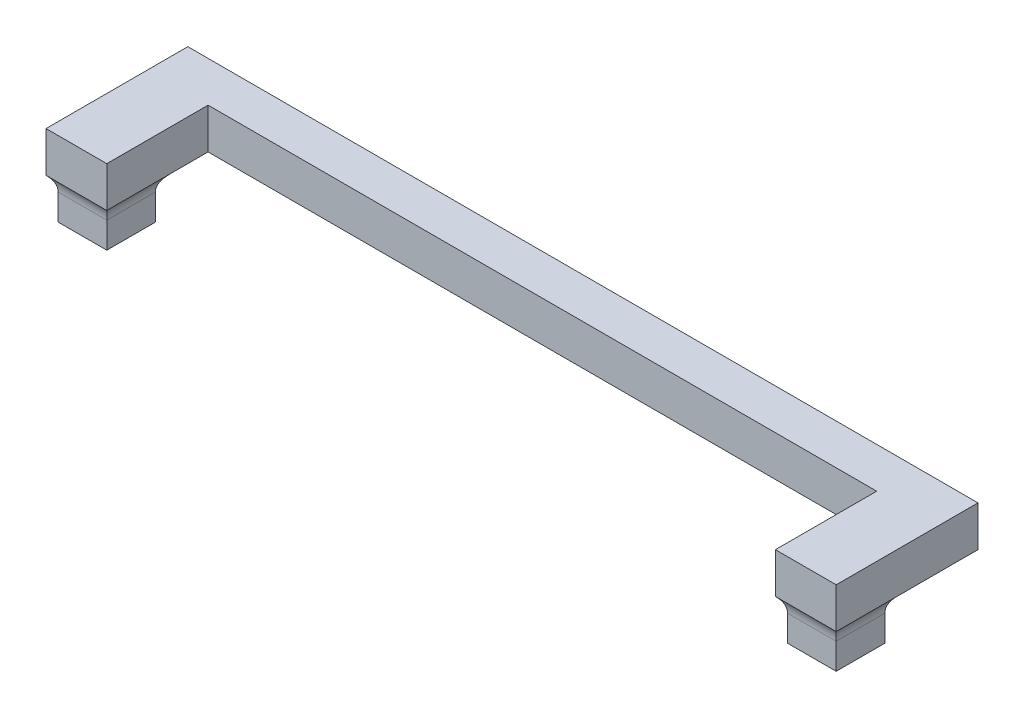
from build123d import *

# Parameters (mm, degrees)
SKETCH1_W           = 6.096
SKETCH1_H           = 6.096
BOSS_EXTRUDE1_DEPTH = 5.08
SKETCH2_W           = 7.62
SKETCH2_H           = 7.62
BOSS_EXTRUDE2_DEPTH = 5.08
FILLET1_R           = 2.54
SKETCH3_W           = 7.62
SKETCH3_H           = 5.08
BOSS_EXTRUDE3_DEPTH = 10.16
SKETCH4_W           = 5.08
SKETCH4_H           = 5.08
BOSS_EXTRUDE4_DEPTH = 83.82
SKETCH6_W           = 5.08
SKETCH6_H           = 5.08
BOSS_EXTRUDE5_DEPTH = 7.62
SKETCH8_W           = 7.62
SKETCH8_H           = 5.08
BOSS_EXTRUDE6_DEPTH = 12.7
SKETCH9_W           = 6.096
SKETCH9_H           = 6.096
BOSS_EXTRUDE7_DEPTH = 5.08
FILLET7_R           = 2.54
FILLET8_R           = 2.54
FILLET9_R           = 2.54
FILLET11_R          = 1.778


with BuildPart() as part:
    # Sketch1 → Boss-Extrude1 (new body)
    with BuildSketch(Plane(origin=(0, 0, 0), x_dir=(1, 0, 0), z_dir=(0, 1, 0))):
        with Locations((3.048, 3.048)):
            Rectangle(SKETCH1_W, SKETCH1_H)
    extrude(amount=BOSS_EXTRUDE1_DEPTH)

    # Sketch2 → Boss-Extrude2 (add)
    with BuildSketch(Plane(origin=(0, 5.08, 0), x_dir=(1, 0, 0), z_dir=(0, 1, 0))):
        with Locations((3.048, 3.048)):
            Rectangle(SKETCH2_W, SKETCH2_H)
    extrude(amount=BOSS_EXTRUDE2_DEPTH)

    # Fillet1
    # the kernel refuses this fillet: 2.54 mm, written as the material it adds along each edge
    with BuildSketch(Plane(origin=(6.096, 5.08, 0), x_dir=(1, 0, 0), z_dir=(0, 0, -1)), Plane(origin=(6.096, 5.08, -6.096), x_dir=(0, 0, -1), z_dir=(-1, 0, 0)), Plane(origin=(0, 5.08, -6.096), x_dir=(-1, 0, 0), z_dir=(0, 0, 1)), Plane(origin=(0, 5.08, 0), x_dir=(0, 0, 1), z_dir=(1, 0, 0))) as fillet1_piece_1:
        with BuildLine():
            CenterArc((2.54, 1.813922821), FILLET1_R, 180, 45.572995999)
            Line((0, 1.813922821), (-0.0508, 1.813922821))
            Line((-0.0508, 1.813922821), (-0.0508, 0))
            Line((-0.0508, 0), (0, -0.0508))
            ThreePointArc((0, -0.0508), (0.381, -0.0508), (0.72644, -0.036278456))
            Line((0.72644, -0.036278456), (0.762, 0))
        make_face()
    extrude(amount=6.096)
    with BuildSketch(Plane(origin=(6.096, 5.08, 4.534807052), x_dir=(1, 0, 0), z_dir=(0, 0, -1))) as fillet1_piece_2a_section:
        with BuildLine():
            CenterArc((2.54, 1.813922821), FILLET1_R, 180, 45.572995999)
            Line((0, 1.813922821), (-0.0508, 1.813922821))
            Line((-0.0508, 1.813922821), (-0.0508, 0))
            Line((-0.0508, 0), (0, -0.0508))
            ThreePointArc((0, -0.0508), (0.381, -0.0508), (0.72644, -0.036278456))
            Line((0.72644, -0.036278456), (0.762, 0))
        make_face()
    fillet1_piece_2a = extrude(amount=10.630807052, mode=Mode.PRIVATE)
    fillet1_piece_2a = split(fillet1_piece_2a, bisect_by=Plane(origin=(6.284412047, 4.594869389, 0.762), z_dir=(0, 0, -1)), keep=Keep.TOP, mode=Mode.PRIVATE)
    fillet1_piece_2a = split(fillet1_piece_2a, bisect_by=Plane(origin=(6.284412047, 4.594869389, 0), z_dir=(0, 0, 1)), keep=Keep.TOP, mode=Mode.PRIVATE)
    with BuildSketch(Plane(origin=(0, 5.08, 0), x_dir=(0, 0, 1), z_dir=(1, 0, 0))) as fillet1_piece_2b_section:
        with BuildLine():
            CenterArc((2.54, 1.813922821), FILLET1_R, 180, 45.572995999)
            Line((0, 1.813922821), (-0.0508, 1.813922821))
            Line((-0.0508, 1.813922821), (-0.0508, 0))
            Line((-0.0508, 0), (0, -0.0508))
            ThreePointArc((0, -0.0508), (0.381, -0.0508), (0.72644, -0.036278456))
            Line((0.72644, -0.036278456), (0.762, 0))
        make_face()
    fillet1_piece_2b = extrude(amount=10.630807052, mode=Mode.PRIVATE)
    fillet1_piece_2b = split(fillet1_piece_2b, bisect_by=Plane(origin=(6.858, 4.594869389, 0.188412047), z_dir=(-1, 0, 0)), keep=Keep.TOP, mode=Mode.PRIVATE)
    fillet1_piece_2b = split(fillet1_piece_2b, bisect_by=Plane(origin=(6.096, 4.594869389, 0.188412047), z_dir=(1, 0, 0)), keep=Keep.TOP, mode=Mode.PRIVATE)
    fillet1_piece_2 = fillet1_piece_2a & fillet1_piece_2b
    add(fillet1_piece_2)
    with BuildSketch(Plane(origin=(10.630807052, 5.08, -6.096), x_dir=(0, 0, -1), z_dir=(-1, 0, 0))) as fillet1_piece_3a_section:
        with BuildLine():
            CenterArc((2.54, 1.813922821), FILLET1_R, 180, 45.572995999)
            Line((0, 1.813922821), (-0.0508, 1.813922821))
            Line((-0.0508, 1.813922821), (-0.0508, 0))
            Line((-0.0508, 0), (0, -0.0508))
            ThreePointArc((0, -0.0508), (0.381, -0.0508), (0.72644, -0.036278456))
            Line((0.72644, -0.036278456), (0.762, 0))
        make_face()
    fillet1_piece_3a = extrude(amount=10.630807052, mode=Mode.PRIVATE)
    fillet1_piece_3a = split(fillet1_piece_3a, bisect_by=Plane(origin=(6.858, 4.594869389, -6.284412047), z_dir=(-1, 0, 0)), keep=Keep.TOP, mode=Mode.PRIVATE)
    fillet1_piece_3a = split(fillet1_piece_3a, bisect_by=Plane(origin=(6.096, 4.594869389, -6.284412047), z_dir=(1, 0, 0)), keep=Keep.TOP, mode=Mode.PRIVATE)
    with BuildSketch(Plane(origin=(6.096, 5.08, 0), x_dir=(1, 0, 0), z_dir=(0, 0, -1))) as fillet1_piece_3b_section:
        with BuildLine():
            CenterArc((2.54, 1.813922821), FILLET1_R, 180, 45.572995999)
            Line((0, 1.813922821), (-0.0508, 1.813922821))
            Line((-0.0508, 1.813922821), (-0.0508, 0))
            Line((-0.0508, 0), (0, -0.0508))
            ThreePointArc((0, -0.0508), (0.381, -0.0508), (0.72644, -0.036278456))
            Line((0.72644, -0.036278456), (0.762, 0))
        make_face()
    fillet1_piece_3b = extrude(amount=10.630807052, mode=Mode.PRIVATE)
    fillet1_piece_3b = split(fillet1_piece_3b, bisect_by=Plane(origin=(6.284412047, 4.594869389, -6.858), z_dir=(0, 0, 1)), keep=Keep.TOP, mode=Mode.PRIVATE)
    fillet1_piece_3b = split(fillet1_piece_3b, bisect_by=Plane(origin=(6.284412047, 4.594869389, -6.096), z_dir=(0, 0, -1)), keep=Keep.TOP, mode=Mode.PRIVATE)
    fillet1_piece_3 = fillet1_piece_3a & fillet1_piece_3b
    add(fillet1_piece_3)
    with BuildSketch(Plane(origin=(0, 5.08, -10.630807052), x_dir=(-1, 0, 0), z_dir=(0, 0, 1))) as fillet1_piece_4a_section:
        with BuildLine():
            CenterArc((2.54, 1.813922821), FILLET1_R, 180, 45.572995999)
            Line((0, 1.813922821), (-0.0508, 1.813922821))
            Line((-0.0508, 1.813922821), (-0.0508, 0))
            Line((-0.0508, 0), (0, -0.0508))
            ThreePointArc((0, -0.0508), (0.381, -0.0508), (0.72644, -0.036278456))
            Line((0.72644, -0.036278456), (0.762, 0))
        make_face()
    fillet1_piece_4a = extrude(amount=10.630807052, mode=Mode.PRIVATE)
    fillet1_piece_4a = split(fillet1_piece_4a, bisect_by=Plane(origin=(-0.188412047, 4.594869389, -6.858), z_dir=(0, 0, 1)), keep=Keep.TOP, mode=Mode.PRIVATE)
    fillet1_piece_4a = split(fillet1_piece_4a, bisect_by=Plane(origin=(-0.188412047, 4.594869389, -6.096), z_dir=(0, 0, -1)), keep=Keep.TOP, mode=Mode.PRIVATE)
    with BuildSketch(Plane(origin=(6.096, 5.08, -6.096), x_dir=(0, 0, -1), z_dir=(-1, 0, 0))) as fillet1_piece_4b_section:
        with BuildLine():
            CenterArc((2.54, 1.813922821), FILLET1_R, 180, 45.572995999)
            Line((0, 1.813922821), (-0.0508, 1.813922821))
            Line((-0.0508, 1.813922821), (-0.0508, 0))
            Line((-0.0508, 0), (0, -0.0508))
            ThreePointArc((0, -0.0508), (0.381, -0.0508), (0.72644, -0.036278456))
            Line((0.72644, -0.036278456), (0.762, 0))
        make_face()
    fillet1_piece_4b = extrude(amount=10.630807052, mode=Mode.PRIVATE)
    fillet1_piece_4b = split(fillet1_piece_4b, bisect_by=Plane(origin=(-0.762, 4.594869389, -6.284412047), z_dir=(1, 0, 0)), keep=Keep.TOP, mode=Mode.PRIVATE)
    fillet1_piece_4b = split(fillet1_piece_4b, bisect_by=Plane(origin=(0, 4.594869389, -6.284412047), z_dir=(-1, 0, 0)), keep=Keep.TOP, mode=Mode.PRIVATE)
    fillet1_piece_4 = fillet1_piece_4a & fillet1_piece_4b
    add(fillet1_piece_4)
    with BuildSketch(Plane(origin=(0, 5.08, -6.096), x_dir=(-1, 0, 0), z_dir=(0, 0, 1))) as fillet1_piece_5a_section:
        with BuildLine():
            CenterArc((2.54, 1.813922821), FILLET1_R, 180, 45.572995999)
            Line((0, 1.813922821), (-0.0508, 1.813922821))
            Line((-0.0508, 1.813922821), (-0.0508, 0))
            Line((-0.0508, 0), (0, -0.0508))
            ThreePointArc((0, -0.0508), (0.381, -0.0508), (0.72644, -0.036278456))
            Line((0.72644, -0.036278456), (0.762, 0))
        make_face()
    fillet1_piece_5a = extrude(amount=10.630807052, mode=Mode.PRIVATE)
    fillet1_piece_5a = split(fillet1_piece_5a, bisect_by=Plane(origin=(-0.188412047, 4.594869389, 0.762), z_dir=(0, 0, -1)), keep=Keep.TOP, mode=Mode.PRIVATE)
    fillet1_piece_5a = split(fillet1_piece_5a, bisect_by=Plane(origin=(-0.188412047, 4.594869389, 0), z_dir=(0, 0, 1)), keep=Keep.TOP, mode=Mode.PRIVATE)
    with BuildSketch(Plane(origin=(-4.534807052, 5.08, 0), x_dir=(0, 0, 1), z_dir=(1, 0, 0))) as fillet1_piece_5b_section:
        with BuildLine():
            CenterArc((2.54, 1.813922821), FILLET1_R, 180, 45.572995999)
            Line((0, 1.813922821), (-0.0508, 1.813922821))
            Line((-0.0508, 1.813922821), (-0.0508, 0))
            Line((-0.0508, 0), (0, -0.0508))
            ThreePointArc((0, -0.0508), (0.381, -0.0508), (0.72644, -0.036278456))
            Line((0.72644, -0.036278456), (0.762, 0))
        make_face()
    fillet1_piece_5b = extrude(amount=10.630807052, mode=Mode.PRIVATE)
    fillet1_piece_5b = split(fillet1_piece_5b, bisect_by=Plane(origin=(-0.762, 4.594869389, 0.188412047), z_dir=(1, 0, 0)), keep=Keep.TOP, mode=Mode.PRIVATE)
    fillet1_piece_5b = split(fillet1_piece_5b, bisect_by=Plane(origin=(0, 4.594869389, 0.188412047), z_dir=(-1, 0, 0)), keep=Keep.TOP, mode=Mode.PRIVATE)
    fillet1_piece_5 = fillet1_piece_5a & fillet1_piece_5b
    add(fillet1_piece_5)

    # Sketch3 → Boss-Extrude3 (add)
    with BuildSketch(Plane(origin=(0, 0, -6.858), x_dir=(-1, 0, 0), z_dir=(0, 0, -1))):
        with Locations((-3.048, 7.62)):
            Rectangle(SKETCH3_W, SKETCH3_H)
    extrude(amount=BOSS_EXTRUDE3_DEPTH)

    # Sketch4 → Boss-Extrude4 (add)
    with BuildSketch(Plane.ZY.offset(0.762)):
        with Locations((-14.478, 7.62)):
            Rectangle(SKETCH4_W, SKETCH4_H)
    extrude(amount=BOSS_EXTRUDE4_DEPTH)

    # Sketch6 → Boss-Extrude5 (add)
    with BuildSketch(Plane.ZY.offset(84.582)):
        with Locations((-14.478, 7.62)):
            Rectangle(SKETCH6_W, SKETCH6_H)
    extrude(amount=BOSS_EXTRUDE5_DEPTH)

    # Sketch8 → Boss-Extrude6 (add)
    with BuildSketch(Plane.XY.offset(-11.938)):
        with Locations((-88.392, 7.62)):
            Rectangle(SKETCH8_W, SKETCH8_H)
    extrude(amount=BOSS_EXTRUDE6_DEPTH)

    # Sketch9 → Boss-Extrude7 (add)
    with BuildSketch(Plane.XZ.offset(-5.08)):
        with Locations((-88.392, -3.048)):
            Rectangle(SKETCH9_W, SKETCH9_H)
    extrude(amount=BOSS_EXTRUDE7_DEPTH)

    # Fillet7
    # the kernel refuses this fillet: 2.54 mm, written as the material it adds along each edge
    with BuildSketch(Plane(origin=(-85.344, 5.08, 0), x_dir=(1, 0, 0), z_dir=(0, 0, -1))) as fillet7_piece_1:
        with BuildLine():
            CenterArc((2.54, 1.813922821), FILLET7_R, 180, 45.572995999)
            Line((0, 1.813922821), (-0.0508, 1.813922821))
            Line((-0.0508, 1.813922821), (-0.0508, 0))
            Line((-0.0508, 0), (0, -0.0508))
            ThreePointArc((0, -0.0508), (0.381, -0.0508), (0.72644, -0.036278456))
            Line((0.72644, -0.036278456), (0.762, 0))
        make_face()
    extrude(amount=6.096)

    # Fillet8
    # the kernel refuses this fillet: 2.54 mm, written as the material it adds along each edge
    with BuildSketch(Plane(origin=(-84.582, 5.08, 0), x_dir=(0, 0, 1), z_dir=(-1, 0, 0))) as fillet8_piece_1_section:
        with BuildLine():
            CenterArc((2.54, -1.813922821), FILLET8_R, 134.427004001, 45.572995999)
            Line((0, -1.813922821), (-0.0508, -1.813922821))
            Line((-0.0508, -1.813922821), (-0.0508, 0))
            Line((-0.0508, 0), (0, 0.0508))
            ThreePointArc((0, 0.0508), (0.381, 0.0508), (0.72644, 0.036278456))
            Line((0.72644, 0.036278456), (0.762, 0))
        make_face()
    fillet8_piece_1 = extrude(amount=6.858, mode=Mode.PRIVATE)
    fillet8_piece_1 = fillet8_piece_1 - Plane(origin=(-82.804, 3.266077179, 0.249051063), x_dir=(1, 0, 0), z_dir=(0, 0, 1)) * Cylinder(2.54, 21, mode=Mode.PRIVATE)
    add(fillet8_piece_1)

    # Fillet9
    # the kernel refuses this fillet: 2.54 mm, written as the material it adds along each edge
    with BuildSketch(Plane(origin=(-91.44, 5.08, 0.762), x_dir=(-1, 0, 0), z_dir=(0, 0, -1))) as fillet9_piece_1_section:
        with BuildLine():
            CenterArc((2.54, -1.813922821), FILLET9_R, 134.427004001, 45.572995999)
            Line((0, -1.813922821), (-0.0508, -1.813922821))
            Line((-0.0508, -1.813922821), (-0.0508, 0))
            Line((-0.0508, 0), (0, 0.0508))
            ThreePointArc((0, 0.0508), (0.381, 0.0508), (0.72644, 0.036278456))
            Line((0.72644, 0.036278456), (0.762, 0))
        make_face()
    fillet9_piece_1 = extrude(amount=6.858, mode=Mode.PRIVATE)
    fillet9_piece_1 = fillet9_piece_1 - Plane(origin=(-91.689051063, 3.266077179, 2.54), x_dir=(0, 0, 1), z_dir=(1, 0, 0)) * Cylinder(2.54, 21, mode=Mode.PRIVATE)
    add(fillet9_piece_1)

    # Fillet11
    # the kernel refuses this fillet: 1.778 mm, written as the material it adds along each edge
    with BuildSketch(Plane(origin=(-92.202, 5.08, -6.096), x_dir=(0, 0, -1), z_dir=(1, 0, 0))) as fillet11_piece_1_section:
        with BuildLine():
            CenterArc((FILLET11_R, -FILLET11_R), FILLET11_R, 90, 90)
            Line((0, -FILLET11_R), (0, 0))
            Line((0, 0), (FILLET11_R, 0))
        make_face()
    fillet11_piece_1 = extrude(amount=7.62, mode=Mode.PRIVATE)
    fillet11_piece_1 = fillet11_piece_1 - Plane(origin=(-93.98, 3.266077179, -6.513594947), x_dir=(-1, 0, 0), z_dir=(0, 0, 1)) * Cylinder(2.54, 23, mode=Mode.PRIVATE)
    fillet11_piece_1 = fillet11_piece_1 - Plane(origin=(-82.804, 3.266077179, -6.513594947), x_dir=(1, 0, 0), z_dir=(0, 0, 1)) * Cylinder(2.54, 23, mode=Mode.PRIVATE)
    add(fillet11_piece_1)


solid = part.part
